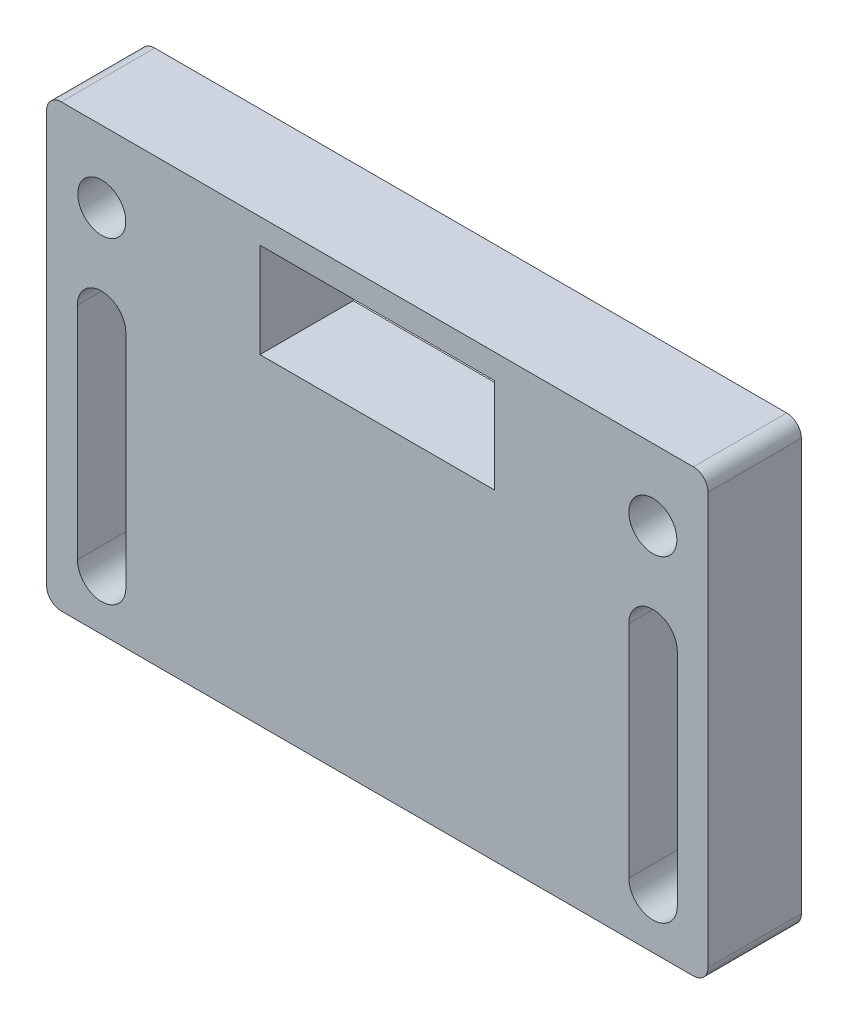
from build123d import *

# Parameters (mm, degrees)
SKETCH1_W                                        = 90
SKETCH1_H                                        = 60
BOSS_EXTRUDE1_DEPTH                              = 12.7
CSK_FOR_1_4_FLAT_HEAD_MACHINE_SCREW1_D           = 6.5278
CSK_FOR_1_4_FLAT_HEAD_MACHINE_SCREW1_CSINK_D     = 12.8778
CSK_FOR_1_4_FLAT_HEAD_MACHINE_SCREW1_CSINK_ANGLE = 82
FILLET1_R                                        = 2
CUT_EXTRUDE1_DEPTH                               = 109.909549627


with BuildPart() as part:
    # Sketch1 → Boss-Extrude1 (new body)
    with BuildSketch(Plane.XY):
        with Locations((45, -30)):
            Rectangle(SKETCH1_W, SKETCH1_H)
        Polygon((29.025, -3.367091904), (29.025, -16.267091904), (60.975, -16.267091904), (60.975, -3.367091904), (45, -3.367091904), align=None, mode=Mode.SUBTRACT)
    extrude(amount=BOSS_EXTRUDE1_DEPTH)

    # CSK for 1/4 Flat Head Machine Screw1 (through all)
    with Locations(Plane(origin=(0, 0, 0), x_dir=(-1, 0, 0), z_dir=(0, 0, -1))):
        with Locations((-82.49, -9.717091904), (-7.51, -9.717091904)):
            CounterSinkHole(CSK_FOR_1_4_FLAT_HEAD_MACHINE_SCREW1_D / 2, CSK_FOR_1_4_FLAT_HEAD_MACHINE_SCREW1_CSINK_D / 2, counter_sink_angle=CSK_FOR_1_4_FLAT_HEAD_MACHINE_SCREW1_CSINK_ANGLE)

    # Fillet1
    fillet1_edges = [part.edges().sort_by_distance(p)[0] for p in [
        (0, -60, 6.35),
        (0, 0, 6.35),
        (90, 0, 6.35),
        (90, -60, 6.35),
    ]]
    fillet(fillet1_edges, radius=FILLET1_R)

    # Sketch5 → Cut-Extrude1 (cut, through all)
    with BuildSketch(Plane(origin=(0, 0, 0), x_dir=(-1, 0, 0), z_dir=(0, 0, -1))):
        with BuildLine():
            Line((-10.785, -22.847364981), (-10.785, -52.847364981))
            ThreePointArc((-10.785, -52.847364981), (-7.485, -56.147364981), (-4.185, -52.847364981))
            Line((-4.185, -52.847364981), (-4.185, -22.847364981))
            ThreePointArc((-4.185, -22.847364981), (-7.485, -19.547364981), (-10.785, -22.847364981))
        make_face()
        with BuildLine():
            Line((-79.215, -52.847364981), (-79.215, -22.847364981))
            ThreePointArc((-79.215, -22.847364981), (-82.515, -19.547364981), (-85.815, -22.847364981))
            Line((-85.815, -22.847364981), (-85.815, -52.847364981))
            ThreePointArc((-85.815, -52.847364981), (-82.515, -56.147364981), (-79.215, -52.847364981))
        make_face()
    extrude(amount=-CUT_EXTRUDE1_DEPTH, mode=Mode.SUBTRACT)


solid = part.part
